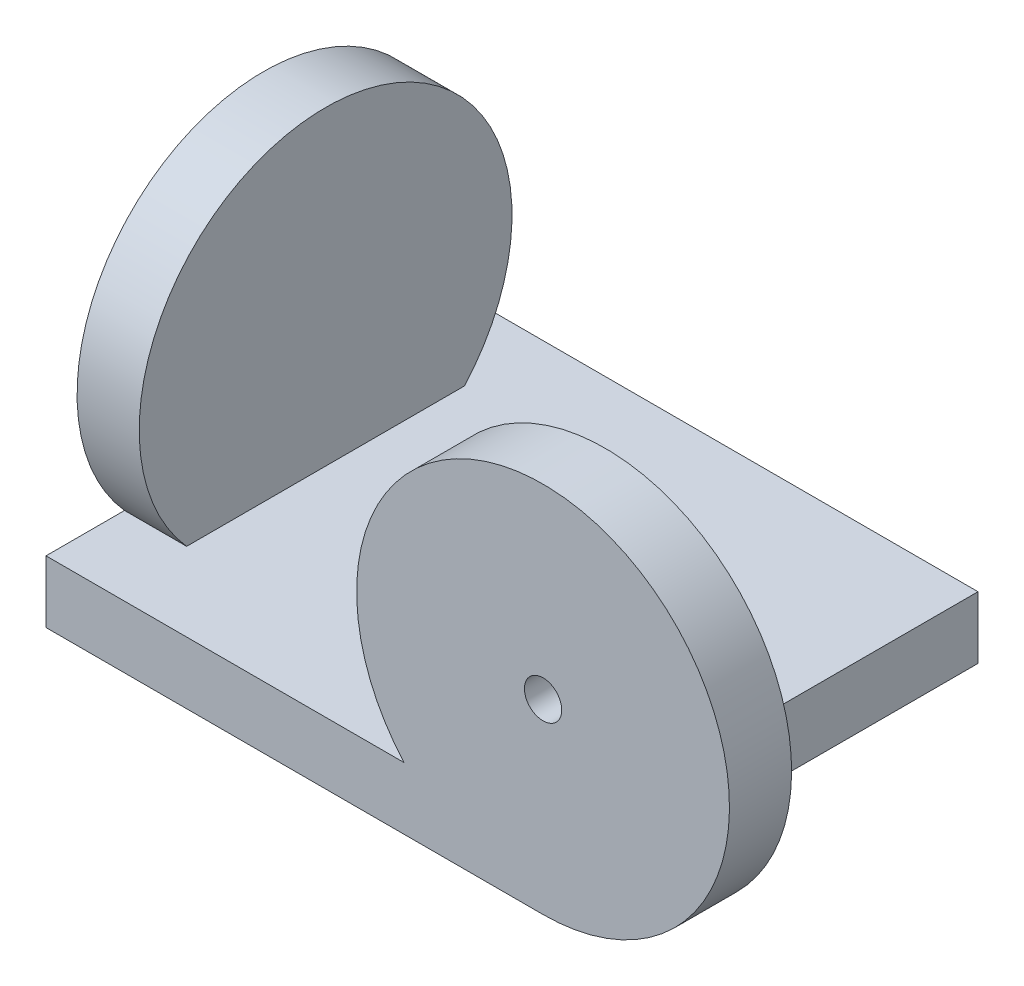
from build123d import *

# Parameters (mm, degrees)
SKETCH1_R                 = 30
BOSS_EXTRUDE1_DEPTH       = 10
SKETCH2_W                 = 80
SKETCH2_H                 = 10
BOSS_EXTRUDE2_DEPTH       = 70
SKETCH3_R                 = 30
BOSS_EXTRUDE3_DEPTH       = 10
F_6_0MM_DOWEL_HOLE2_D     = 6
M4X0_7_TAPPED_HOLE1_D     = 3.3
M4X0_7_TAPPED_HOLE1_DEPTH = 6
M4X0_7_TAPPED_HOLE1_TIP   = 0.991420021


with BuildPart() as part:
    # Sketch1 → Boss-Extrude1 (new body)
    with BuildSketch(Plane.XY):
        Circle(SKETCH1_R)
    extrude(amount=BOSS_EXTRUDE1_DEPTH)

    # Sketch2 → Boss-Extrude2 (add)
    with BuildSketch(Plane.XY.offset(10)):
        with Locations((-40, -25)):
            Rectangle(SKETCH2_W, SKETCH2_H)
    extrude(amount=-BOSS_EXTRUDE2_DEPTH)

    # Sketch3 → Boss-Extrude3 (add)
    with BuildSketch(Plane.ZY.offset(80)):
        with Locations((-25, 0)):
            Circle(SKETCH3_R)
    extrude(amount=-BOSS_EXTRUDE3_DEPTH)

    # Ø6.0mm Dowel Hole2 (through all)
    with Locations(Plane(origin=(0, 0, 0), x_dir=(-1, 0, 0), z_dir=(0, 0, -1))):
        with Locations((0, 0)):
            Hole(F_6_0MM_DOWEL_HOLE2_D / 2)

    # M4x0.7 Tapped Hole1
    with Locations(Plane(origin=(0, 0, 0), x_dir=(-1, 0, 0), z_dir=(0, 0, -1))):
        with Locations((-15.5, 15.5), (15.5, 15.5), (15.5, -15.5), (-15.5, -15.5)):
            Hole(M4X0_7_TAPPED_HOLE1_D / 2, depth=M4X0_7_TAPPED_HOLE1_DEPTH)
            with Locations((0, 0, -(M4X0_7_TAPPED_HOLE1_DEPTH + M4X0_7_TAPPED_HOLE1_TIP / 2))):  # 118° drill point
                Cone(0, M4X0_7_TAPPED_HOLE1_D / 2, M4X0_7_TAPPED_HOLE1_TIP, mode=Mode.SUBTRACT)


solid = part.part
